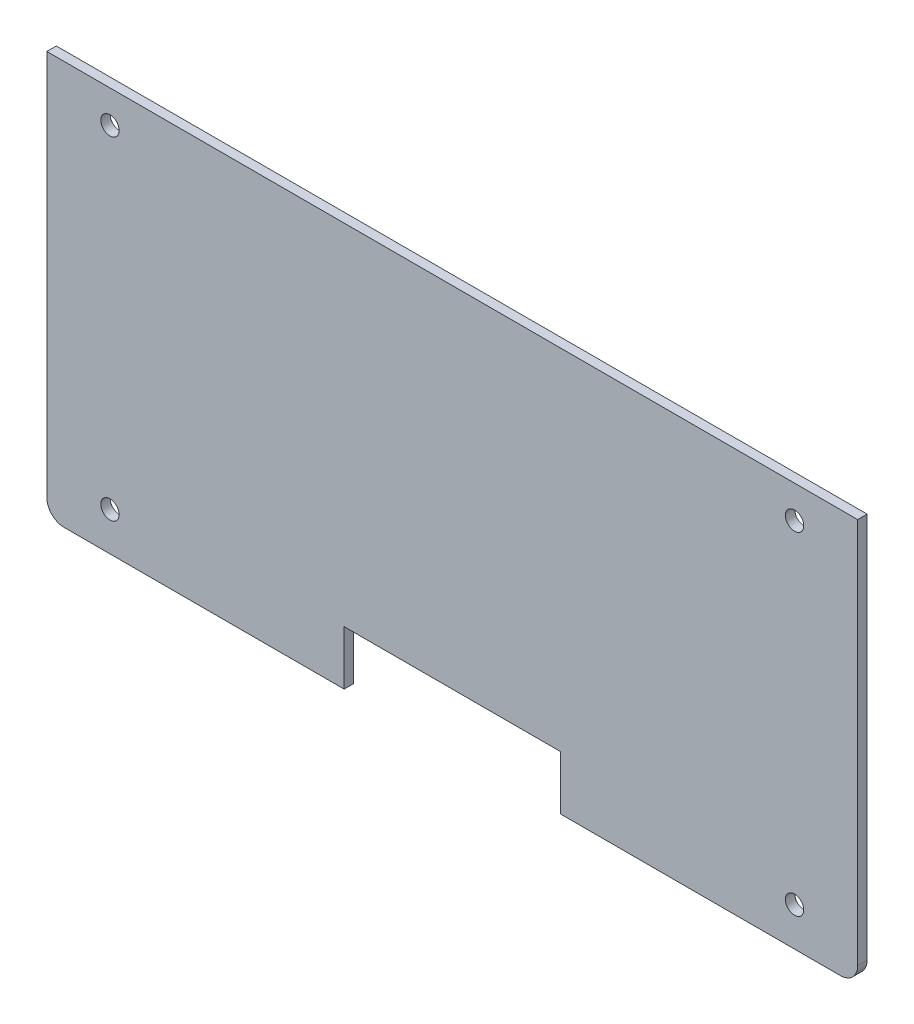
from build123d import *

# Parameters (mm, degrees)
SKETCH1_W            = 150
SKETCH1_H            = 74.66
BASE_FLANGE1_DEPTH   = 1.75
CUT_EXTRUDE1_REACH   = 107.84
SKETCH2_W            = 40
SKETCH2_H            = 10
M3_CLEARANCE_HOLE1_D = 3.4
FILLET1_R            = 3.175


# Sheet-metal steps are written as plain solids
with BuildPart() as part:
    # Sketch1 → Base-Flange1 (new body)
    with BuildSketch(Plane.XY):
        with Locations((0, 37.33)):
            Rectangle(SKETCH1_W, SKETCH1_H)
    extrude(amount=-BASE_FLANGE1_DEPTH)

    # Sketch2 → Cut-Extrude1 (cut, up to next)
    with BuildSketch(Plane.XY, mode=Mode.PRIVATE) as cut_extrude1_sk1:
        with Locations((0, 5)):
            Rectangle(SKETCH2_W, SKETCH2_H)
    cut_extrude1_tool1 = extrude(cut_extrude1_sk1.sketch, amount=-CUT_EXTRUDE1_REACH, mode=Mode.PRIVATE) & part.part
    add(cut_extrude1_tool1.solids().sort_by_distance((0, 5, 0))[0], mode=Mode.SUBTRACT)

    # M3 Clearance Hole1 (through all)
    with Locations(Plane.XY):
        with Locations((63.325, 68.66), (63.325, 7.125)):
            m3_clearance_hole1 = Hole(M3_CLEARANCE_HOLE1_D / 2)

    # Mirror1: M3 Clearance Hole1 across plane
    add(m3_clearance_hole1.mirror(Plane(origin=(0, 0, 0), x_dir=(0, 0, 1), z_dir=(1, 0, 0))), mode=Mode.SUBTRACT)

    # Fillet1
    fillet1_edges = [part.edges().sort_by_distance(p)[0] for p in [
        (75, 0, -0.875),
        (-75, 0, -0.875),
    ]]
    fillet(fillet1_edges, radius=FILLET1_R)


solid = part.part
